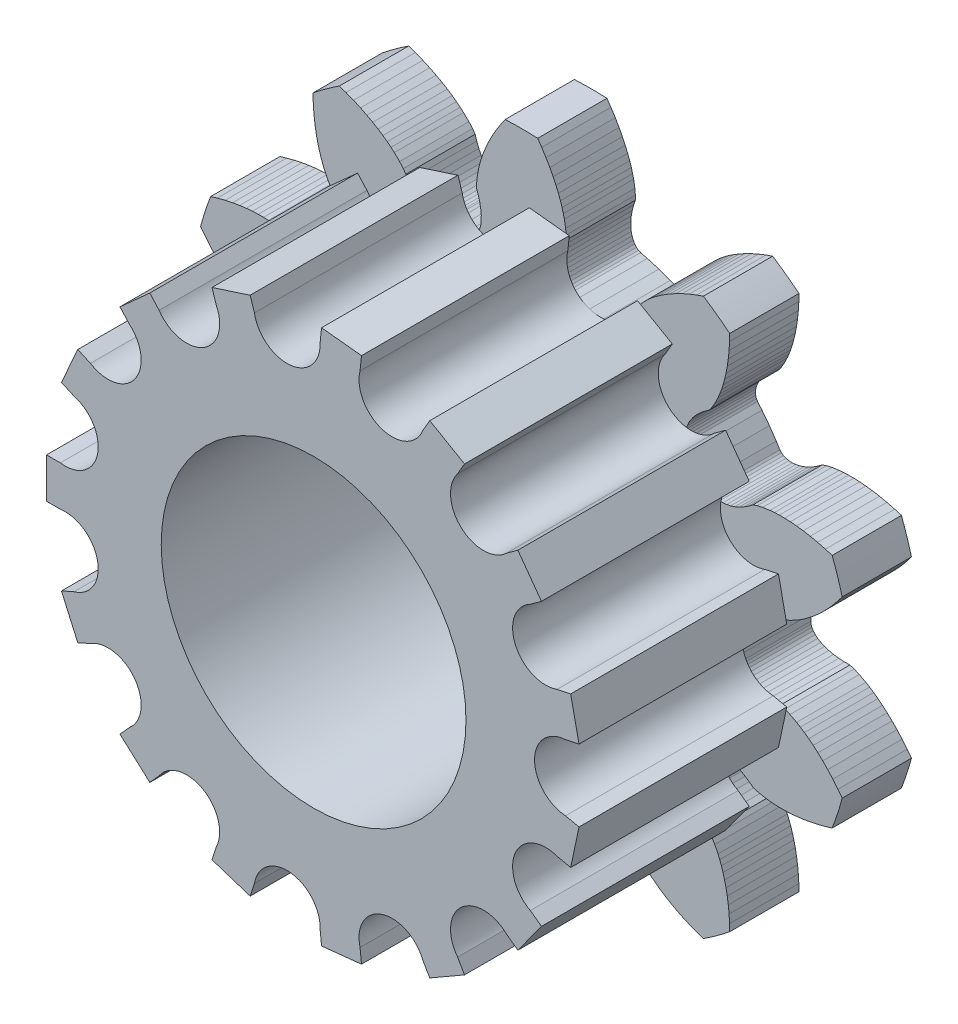
from build123d import *

# Parameters (mm, degrees)
MODEL_R             = 0.5
BOSS_EXTRUDE1_DEPTH = 5
SKETCH2_R           = 11
CUT_EXTRUDE1_DEPTH  = 87.698944957
BOSS_EXTRUDE2_DEPTH = 15
SKETCH4_R           = 11
CUT_EXTRUDE2_DEPTH  = 16


with BuildPart() as part:
    # Model → Boss-Extrude1 (new body)
    with BuildSketch(Plane.XY):
        with BuildLine():
            Line((45.0072197, -17.6135177), (44.9713648, -18.1935982))
            Line((44.9713648, -18.1935982), (44.960078413, -18.702780784))
            ThreePointArc((44.960078413, -18.702780784), (45.893236682, -19.416293937), (46.860189796, -20.083292477))
            Line((46.860189796, -20.083292477), (47.3409636, -19.9152125))
            Line((47.3409636, -19.9152125), (47.8815731, -19.7018577))
            Line((47.8815731, -19.7018577), (48.3832652, -19.4791595))
            Line((48.3832652, -19.4791595), (48.8442917, -19.2509448))
            Line((48.8442917, -19.2509448), (49.2681476, -19.0185598))
            Line((49.2681476, -19.0185598), (49.652488, -18.7863735))
            Line((49.652488, -18.7863735), (49.999784, -18.5561983))
            Line((49.999784, -18.5561983), (50.3097144, -18.3315784))
            Line((50.3097144, -18.3315784), (50.584246, -18.1145512))
            Line((50.584246, -18.1145512), (50.8253064, -17.9070155))
            Line((50.8253064, -17.9070155), (51.2090617, -17.5331754))
            Line((51.2090617, -17.5331754), (51.4736068, -17.2287023))
            Line((51.4736068, -17.2287023), (51.6609452, -16.9687186))
            Line((51.6609452, -16.9687186), (51.7766666, -16.5968373))
            Line((51.7766666, -16.5968373), (51.926219, -16.211607))
            Line((51.926219, -16.211607), (52.09214, -15.8680652))
            Line((52.09214, -15.8680652), (52.2711992, -15.5668343))
            Line((52.2711992, -15.5668343), (52.4601462, -15.3083721))
            Line((52.4601462, -15.3083721), (52.655719, -15.092912))
            Line((52.655719, -15.092912), (52.8546606, -14.9204789))
            Line((52.8546606, -14.9204789), (53.053697, -14.7909236))
            Line((53.053697, -14.7909236), (53.2496281, -14.7039005))
            Line((53.2496281, -14.7039005), (53.4392401, -14.6588488))
            Line((53.4392401, -14.6588488), (53.6193745, -14.6550368))
            Line((53.6193745, -14.6550368), (53.7869408, -14.6915235))
            Line((53.7869408, -14.6915235), (54.2459233, -14.875985))
            Line((54.2459233, -14.875985), (55.0711789, -15.1693514))
            Line((55.0711789, -15.1693514), (55.9112613, -15.4170861))
            Line((55.9112613, -15.4170861), (56.3910096, -15.5376367))
            Line((56.3910096, -15.5376367), (56.5480199, -15.6066114))
            Line((56.5480199, -15.6066114), (56.6915111, -15.7155757))
            Line((56.6915111, -15.7155757), (56.8184297, -15.8634744))
            Line((56.8184297, -15.8634744), (56.9257904, -16.0490431))
            Line((56.9257904, -16.0490431), (57.0106635, -16.2708461))
            Line((57.0106635, -16.2708461), (57.070257, -16.5272824))
            Line((57.070257, -16.5272824), (57.1018345, -16.8165481))
            Line((57.1018345, -16.8165481), (57.1027755, -17.1367086))
            Line((57.1027755, -17.1367086), (57.0705784, -17.485658))
            Line((57.0705784, -17.485658), (57.0028826, -17.861115))
            Line((57.0028826, -17.861115), (56.8974402, -18.2606775))
            Line((56.8974402, -18.2606775), (56.7724745, -18.6295551))
            Line((56.7724745, -18.6295551), (56.7712199, -18.9500011))
            Line((56.7712199, -18.9500011), (56.8062766, -19.3518207))
            Line((56.8062766, -19.3518207), (56.8970034, -19.8798294))
            Line((56.8970034, -19.8798294), (56.9700389, -20.1894211))
            Line((56.9700389, -20.1894211), (57.0645743, -20.5263654))
            Line((57.0645743, -20.5263654), (57.183285, -20.8902593))
            Line((57.183285, -20.8902593), (57.3289597, -21.2806104))
            Line((57.3289597, -21.2806104), (57.503422, -21.6943627))
            Line((57.503422, -21.6943627), (57.7097362, -22.1315024))
            Line((57.7097362, -22.1315024), (57.9485732, -22.5871164))
            Line((57.9485732, -22.5871164), (58.2235519, -23.0621703))
            Line((58.2235519, -23.0621703), (58.5355074, -23.5525403))
            Line((58.5355074, -23.5525403), (58.82566651, -23.971111584))
            ThreePointArc((58.82566651, -23.971111584), (59.999999958, -23.9998592), (61.174333407, -23.971111588))
            Line((61.174333407, -23.971111588), (61.4644926, -23.5525403))
            Line((61.4644926, -23.5525403), (61.7764481, -23.0621703))
            Line((61.7764481, -23.0621703), (62.0514268, -22.5871164))
            Line((62.0514268, -22.5871164), (62.2902638, -22.1315024))
            Line((62.2902638, -22.1315024), (62.496578, -21.6943627))
            Line((62.496578, -21.6943627), (62.6710403, -21.2806104))
            Line((62.6710403, -21.2806104), (62.816715, -20.8902593))
            Line((62.816715, -20.8902593), (62.9354257, -20.5263654))
            Line((62.9354257, -20.5263654), (63.0299611, -20.1894211))
            Line((63.0299611, -20.1894211), (63.1029966, -19.8798294))
            Line((63.1029966, -19.8798294), (63.1937234, -19.3518207))
            Line((63.1937234, -19.3518207), (63.2287801, -18.9500011))
            Line((63.2287801, -18.9500011), (63.2275255, -18.6295551))
            Line((63.2275255, -18.6295551), (63.1025598, -18.2606775))
            Line((63.1025598, -18.2606775), (62.9971174, -17.861115))
            Line((62.9971174, -17.861115), (62.9294216, -17.485658))
            Line((62.9294216, -17.485658), (62.8972245, -17.1367086))
            Line((62.8972245, -17.1367086), (62.8981655, -16.8165481))
            Line((62.8981655, -16.8165481), (62.929743, -16.5272824))
            Line((62.929743, -16.5272824), (62.9893365, -16.2708461))
            Line((62.9893365, -16.2708461), (63.0742096, -16.0490431))
            Line((63.0742096, -16.0490431), (63.1815703, -15.8634744))
            Line((63.1815703, -15.8634744), (63.3084889, -15.7155757))
            Line((63.3084889, -15.7155757), (63.4519801, -15.6066114))
            Line((63.4519801, -15.6066114), (63.6089904, -15.5376367))
            Line((63.6089904, -15.5376367), (64.0887387, -15.4170861))
            Line((64.0887387, -15.4170861), (64.9288211, -15.1693514))
            Line((64.9288211, -15.1693514), (65.7540767, -14.875985))
            Line((65.7540767, -14.875985), (66.2130592, -14.6915235))
            Line((66.2130592, -14.6915235), (66.3806255, -14.6550368))
            Line((66.3806255, -14.6550368), (66.5607599, -14.6588488))
            Line((66.5607599, -14.6588488), (66.7503719, -14.7039005))
            Line((66.7503719, -14.7039005), (66.946303, -14.7909236))
            Line((66.946303, -14.7909236), (67.1453394, -14.9204789))
            Line((67.1453394, -14.9204789), (67.344281, -15.092912))
            Line((67.344281, -15.092912), (67.5398538, -15.3083721))
            Line((67.5398538, -15.3083721), (67.7288008, -15.5668343))
            Line((67.7288008, -15.5668343), (67.90786, -15.8680652))
            Line((67.90786, -15.8680652), (68.073781, -16.211607))
            Line((68.073781, -16.211607), (68.2233334, -16.5968373))
            Line((68.2233334, -16.5968373), (68.3390548, -16.9687186))
            Line((68.3390548, -16.9687186), (68.5263932, -17.2287023))
            Line((68.5263932, -17.2287023), (68.7909383, -17.5331754))
            Line((68.7909383, -17.5331754), (69.1746936, -17.9070155))
            Line((69.1746936, -17.9070155), (69.415754, -18.1145512))
            Line((69.415754, -18.1145512), (69.6902856, -18.3315784))
            Line((69.6902856, -18.3315784), (70.000216, -18.5561983))
            Line((70.000216, -18.5561983), (70.347512, -18.7863735))
            Line((70.347512, -18.7863735), (70.7318524, -19.0185598))
            Line((70.7318524, -19.0185598), (71.1557083, -19.2509448))
            Line((71.1557083, -19.2509448), (71.6167348, -19.4791595))
            Line((71.6167348, -19.4791595), (72.1184269, -19.7018577))
            Line((72.1184269, -19.7018577), (72.6590364, -19.9152125))
            Line((72.6590364, -19.9152125), (73.139810204, -20.083292477))
            ThreePointArc((73.139810204, -20.083292477), (74.106763318, -19.416293937), (75.039921587, -18.702780784))
            Line((75.039921587, -18.702780784), (75.0286352, -18.1935982))
            Line((75.0286352, -18.1935982), (74.9927803, -17.6135177))
            Line((74.9927803, -17.6135177), (74.9360131, -17.0675626))
            Line((74.9360131, -17.0675626), (74.8614331, -16.5585782))
            Line((74.8614331, -16.5585782), (74.7714004, -16.0836564))
            Line((74.7714004, -16.0836564), (74.6693459, -15.6463774))
            Line((74.6693459, -15.6463774), (74.5577566, -15.2449512))
            Line((74.5577566, -15.2449512), (74.4399041, -14.8807785))
            Line((74.4399041, -14.8807785), (74.318334, -14.5526184))
            Line((74.318334, -14.5526184), (74.1954475, -14.2592242))
            Line((74.1954475, -14.2592242), (73.9584913, -13.7787283))
            Line((73.9584913, -13.7787283), (73.7506692, -13.4330436))
            Line((73.7506692, -13.4330436), (73.5613007, -13.1745348))
            Line((73.5613007, -13.1745348), (73.2433805, -12.9495595))
            Line((73.2433805, -12.9495595), (72.9232189, -12.6882841))
            Line((72.9232189, -12.6882841), (72.6477637, -12.4243237))
            Line((72.6477637, -12.4243237), (72.4166084, -12.1609427))
            Line((72.4166084, -12.1609427), (72.2291841, -11.9013743))
            Line((72.2291841, -11.9013743), (72.0847047, -11.6487926))
            Line((72.0847047, -11.6487926), (71.9821874, -11.4063031))
            Line((71.9821874, -11.4063031), (71.9204786, -11.1769735))
            Line((71.9204786, -11.1769735), (71.8982608, -10.9637403))
            Line((71.8982608, -10.9637403), (71.9140074, -10.7694868))
            Line((71.9140074, -10.7694868), (71.9660466, -10.5969909))
            Line((71.9660466, -10.5969909), (72.0525282, -10.4489008))
            Line((72.0525282, -10.4489008), (72.369795, -10.0693844))
            Line((72.369795, -10.0693844), (72.9038211, -9.3751748))
            Line((72.9038211, -9.3751748), (73.3990305, -8.6527632))
            Line((73.3990305, -8.6527632), (73.6619313, -8.2337476))
            Line((73.6619313, -8.2337476), (73.776049, -8.1057363))
            Line((73.776049, -8.1057363), (73.9240214, -8.0029399))
            Line((73.9240214, -8.0029399), (74.1039014, -7.9279364))
            Line((74.1039014, -7.9279364), (74.313564, -7.8831741))
            Line((74.313564, -7.8831741), (74.5507384, -7.8709959))
            Line((74.5507384, -7.8709959), (74.8130393, -7.8935623))
            Line((74.8130393, -7.8935623), (75.0979052, -7.9529183))
            Line((75.0979052, -7.9529183), (75.4026868, -8.0509584))
            Line((75.4026868, -8.0509584), (75.7246079, -8.1894109))
            Line((75.7246079, -8.1894109), (76.0607696, -8.3698161))
            Line((76.0607696, -8.3698161), (76.4081926, -8.5935693))
            Line((76.4081926, -8.5935693), (76.7203996, -8.8264083))
            Line((76.7203996, -8.8264083), (77.0247741, -8.9266248))
            Line((77.0247741, -8.9266248), (77.4177604, -9.0174529))
            Line((77.4177604, -9.0174529), (77.9479626, -9.0943303))
            Line((77.9479626, -9.0943303), (78.2649711, -9.1205385))
            Line((78.2649711, -9.1205385), (78.6146371, -9.1347515))
            Line((78.6146371, -9.1347515), (78.9974044, -9.1343003))
            Line((78.9974044, -9.1343003), (79.4136663, -9.1163805))
            Line((79.4136663, -9.1163805), (79.86108, -9.0783135))
            Line((79.86108, -9.0783135), (80.3405791, -9.0171807))
            Line((80.3405791, -9.0171807), (80.8476985, -8.9308257))
            Line((80.8476985, -8.9308257), (81.3844747, -8.8161051))
            Line((81.3844747, -8.8161051), (81.9472438, -8.6709504))
            Line((81.9472438, -8.6709504), (82.434992789, -8.524338316))
            ThreePointArc((82.434992789, -8.524338316), (82.825222394, -7.416364364), (83.16077079, -6.290623409))
            Line((83.16077079, -6.290623409), (82.85235, -5.88532))
            Line((82.85235, -5.88532), (82.48238, -5.4371))
            Line((82.48238, -5.4371), (82.11555, -5.02878))
            Line((82.11555, -5.02878), (81.75604, -4.66084))
            Line((81.75604, -4.66084), (81.40405, -4.32954))
            Line((81.40405, -4.32954), (81.06446, -4.03576))
            Line((81.06446, -4.03576), (80.73823, -3.77659))
            Line((80.73823, -3.77659), (80.42883, -3.55124))
            Line((80.42883, -3.55124), (80.13759, -3.35721))
            Line((80.13759, -3.35721), (79.86572, -3.19208))
            Line((79.86572, -3.19208), (79.39159, -2.94263))
            Line((79.39159, -2.94263), (79.02027, -2.78512))
            Line((79.02027, -2.78512), (78.71512, -2.68729))
            Line((78.71512, -2.68729), (78.32568, -2.69215))
            Line((78.32568, -2.69215), (77.91309, -2.66896))
            Line((77.91309, -2.66896), (77.53509, -2.61732))
            Line((77.53509, -2.61732), (77.19327, -2.54011))
            Line((77.19327, -2.54011), (76.88907, -2.44028))
            Line((76.88907, -2.44028), (76.62372, -2.32086))
            Line((76.62372, -2.32086), (76.39825, -2.18494))
            Line((76.39825, -2.18494), (76.21353, -2.03568))
            Line((76.21353, -2.03568), (76.07022, -1.87623))
            Line((76.07022, -1.87623), (75.96878, -1.70982))
            Line((75.96878, -1.70982), (75.90949, -1.53968))
            Line((75.90949, -1.53968), (75.89241, -1.36904))
            Line((75.89241, -1.36904), (75.92601, -0.87552))
            Line((75.92601, -0.87552), (75.95, 0))
            Line((75.95, 0), (75.92601, 0.87552))
            Line((75.92601, 0.87552), (75.89241, 1.36904))
            Line((75.89241, 1.36904), (75.90949, 1.53968))
            Line((75.90949, 1.53968), (75.96878, 1.70982))
            Line((75.96878, 1.70982), (76.07022, 1.87623))
            Line((76.07022, 1.87623), (76.21353, 2.03568))
            Line((76.21353, 2.03568), (76.39825, 2.18494))
            Line((76.39825, 2.18494), (76.62372, 2.32086))
            Line((76.62372, 2.32086), (76.88907, 2.44028))
            Line((76.88907, 2.44028), (77.19327, 2.54011))
            Line((77.19327, 2.54011), (77.53509, 2.61732))
            Line((77.53509, 2.61732), (77.91309, 2.66896))
            Line((77.91309, 2.66896), (78.32568, 2.69215))
            Line((78.32568, 2.69215), (78.71512, 2.68729))
            Line((78.71512, 2.68729), (79.02027, 2.78512))
            Line((79.02027, 2.78512), (79.39159, 2.94263))
            Line((79.39159, 2.94263), (79.86572, 3.19208))
            Line((79.86572, 3.19208), (80.13759, 3.35721))
            Line((80.13759, 3.35721), (80.42883, 3.55124))
            Line((80.42883, 3.55124), (80.73823, 3.77659))
            Line((80.73823, 3.77659), (81.06446, 4.03576))
            Line((81.06446, 4.03576), (81.40405, 4.32954))
            Line((81.40405, 4.32954), (81.75604, 4.66084))
            Line((81.75604, 4.66084), (82.11555, 5.02878))
            Line((82.11555, 5.02878), (82.48238, 5.4371))
            Line((82.48238, 5.4371), (82.85235, 5.88532))
            Line((82.85235, 5.88532), (83.16077089, 6.290623409))
            ThreePointArc((83.16077089, 6.290623409), (82.825222494, 7.416364364), (82.434992889, 8.524338316))
            Line((82.434992889, 8.524338316), (81.9472438, 8.6709504))
            Line((81.9472438, 8.6709504), (81.3844747, 8.8161051))
            Line((81.3844747, 8.8161051), (80.8476985, 8.9308257))
            Line((80.8476985, 8.9308257), (80.3405791, 9.0171807))
            Line((80.3405791, 9.0171807), (79.86108, 9.0783135))
            Line((79.86108, 9.0783135), (79.4136663, 9.1163805))
            Line((79.4136663, 9.1163805), (78.9974044, 9.1343003))
            Line((78.9974044, 9.1343003), (78.6146371, 9.1347515))
            Line((78.6146371, 9.1347515), (78.2649711, 9.1205385))
            Line((78.2649711, 9.1205385), (77.9479626, 9.0943303))
            Line((77.9479626, 9.0943303), (77.4177604, 9.0174529))
            Line((77.4177604, 9.0174529), (77.0247741, 8.9266248))
            Line((77.0247741, 8.9266248), (76.7203996, 8.8264083))
            Line((76.7203996, 8.8264083), (76.4081926, 8.5935693))
            Line((76.4081926, 8.5935693), (76.0607696, 8.3698161))
            Line((76.0607696, 8.3698161), (75.7246079, 8.1894109))
            Line((75.7246079, 8.1894109), (75.4026868, 8.0509584))
            Line((75.4026868, 8.0509584), (75.0979052, 7.9529183))
            Line((75.0979052, 7.9529183), (74.8130393, 7.8935623))
            Line((74.8130393, 7.8935623), (74.5507384, 7.8709959))
            Line((74.5507384, 7.8709959), (74.313564, 7.8831741))
            Line((74.313564, 7.8831741), (74.1039014, 7.9279364))
            Line((74.1039014, 7.9279364), (73.9240214, 8.0029399))
            Line((73.9240214, 8.0029399), (73.776049, 8.1057363))
            Line((73.776049, 8.1057363), (73.6619313, 8.2337476))
            Line((73.6619313, 8.2337476), (73.3990305, 8.6527632))
            Line((73.3990305, 8.6527632), (72.9038211, 9.3751748))
            Line((72.9038211, 9.3751748), (72.369795, 10.0693844))
            Line((72.369795, 10.0693844), (72.0525282, 10.4489008))
            Line((72.0525282, 10.4489008), (71.9660466, 10.5969909))
            Line((71.9660466, 10.5969909), (71.9140074, 10.7694868))
            Line((71.9140074, 10.7694868), (71.8982608, 10.9637403))
            Line((71.8982608, 10.9637403), (71.9204786, 11.1769735))
            Line((71.9204786, 11.1769735), (71.9821874, 11.4063031))
            Line((71.9821874, 11.4063031), (72.0847047, 11.6487926))
            Line((72.0847047, 11.6487926), (72.2291841, 11.9013743))
            Line((72.2291841, 11.9013743), (72.4166084, 12.1609427))
            Line((72.4166084, 12.1609427), (72.6477637, 12.4243237))
            Line((72.6477637, 12.4243237), (72.9232189, 12.6882841))
            Line((72.9232189, 12.6882841), (73.2433805, 12.9495595))
            Line((73.2433805, 12.9495595), (73.5613007, 13.1745348))
            Line((73.5613007, 13.1745348), (73.7506692, 13.4330436))
            Line((73.7506692, 13.4330436), (73.9584913, 13.7787283))
            Line((73.9584913, 13.7787283), (74.1954475, 14.2592242))
            Line((74.1954475, 14.2592242), (74.318334, 14.5526184))
            Line((74.318334, 14.5526184), (74.4399041, 14.8807785))
            Line((74.4399041, 14.8807785), (74.5577566, 15.2449512))
            Line((74.5577566, 15.2449512), (74.6693459, 15.6463774))
            Line((74.6693459, 15.6463774), (74.7714004, 16.0836564))
            Line((74.7714004, 16.0836564), (74.8614331, 16.5585782))
            Line((74.8614331, 16.5585782), (74.9360131, 17.0675626))
            Line((74.9360131, 17.0675626), (74.9927803, 17.6135177))
            Line((74.9927803, 17.6135177), (75.0286352, 18.1935982))
            Line((75.0286352, 18.1935982), (75.039921587, 18.702780784))
            ThreePointArc((75.039921587, 18.702780784), (74.106763318, 19.416293937), (73.139810204, 20.083292477))
            Line((73.139810204, 20.083292477), (72.6590364, 19.9152125))
            Line((72.6590364, 19.9152125), (72.1184269, 19.7018577))
            Line((72.1184269, 19.7018577), (71.6167348, 19.4791595))
            Line((71.6167348, 19.4791595), (71.1557083, 19.2509448))
            Line((71.1557083, 19.2509448), (70.7318524, 19.0185598))
            Line((70.7318524, 19.0185598), (70.347512, 18.7863735))
            Line((70.347512, 18.7863735), (70.000216, 18.5561983))
            Line((70.000216, 18.5561983), (69.6902856, 18.3315784))
            Line((69.6902856, 18.3315784), (69.415754, 18.1145512))
            Line((69.415754, 18.1145512), (69.1746936, 17.9070155))
            Line((69.1746936, 17.9070155), (68.7909383, 17.5331754))
            Line((68.7909383, 17.5331754), (68.5263932, 17.2287023))
            Line((68.5263932, 17.2287023), (68.3390548, 16.9687186))
            Line((68.3390548, 16.9687186), (68.2233334, 16.5968373))
            Line((68.2233334, 16.5968373), (68.073781, 16.211607))
            Line((68.073781, 16.211607), (67.90786, 15.8680652))
            Line((67.90786, 15.8680652), (67.7288008, 15.5668343))
            Line((67.7288008, 15.5668343), (67.5398538, 15.3083721))
            Line((67.5398538, 15.3083721), (67.344281, 15.092912))
            Line((67.344281, 15.092912), (67.1453394, 14.9204789))
            Line((67.1453394, 14.9204789), (66.946303, 14.7909236))
            Line((66.946303, 14.7909236), (66.7503719, 14.7039005))
            Line((66.7503719, 14.7039005), (66.5607599, 14.6588488))
            Line((66.5607599, 14.6588488), (66.3806255, 14.6550368))
            Line((66.3806255, 14.6550368), (66.2130592, 14.6915235))
            Line((66.2130592, 14.6915235), (65.7540767, 14.875985))
            Line((65.7540767, 14.875985), (64.9288211, 15.1693514))
            Line((64.9288211, 15.1693514), (64.0887387, 15.4170861))
            Line((64.0887387, 15.4170861), (63.6089904, 15.5376367))
            Line((63.6089904, 15.5376367), (63.4519801, 15.6066114))
            Line((63.4519801, 15.6066114), (63.3084889, 15.7155757))
            Line((63.3084889, 15.7155757), (63.1815703, 15.8634744))
            Line((63.1815703, 15.8634744), (63.0742096, 16.0490431))
            Line((63.0742096, 16.0490431), (62.9893365, 16.2708461))
            Line((62.9893365, 16.2708461), (62.929743, 16.5272824))
            Line((62.929743, 16.5272824), (62.8981655, 16.8165481))
            Line((62.8981655, 16.8165481), (62.8972245, 17.1367086))
            Line((62.8972245, 17.1367086), (62.9294216, 17.485658))
            Line((62.9294216, 17.485658), (62.9971174, 17.861115))
            Line((62.9971174, 17.861115), (63.1025598, 18.2606775))
            Line((63.1025598, 18.2606775), (63.2275255, 18.6295551))
            Line((63.2275255, 18.6295551), (63.2287801, 18.9500011))
            Line((63.2287801, 18.9500011), (63.1937234, 19.3518207))
            Line((63.1937234, 19.3518207), (63.1029966, 19.8798294))
            Line((63.1029966, 19.8798294), (63.0299611, 20.1894211))
            Line((63.0299611, 20.1894211), (62.9354257, 20.5263654))
            Line((62.9354257, 20.5263654), (62.816715, 20.8902593))
            Line((62.816715, 20.8902593), (62.6710403, 21.2806104))
            Line((62.6710403, 21.2806104), (62.496578, 21.6943627))
            Line((62.496578, 21.6943627), (62.2902638, 22.1315024))
            Line((62.2902638, 22.1315024), (62.0514268, 22.5871164))
            Line((62.0514268, 22.5871164), (61.7764481, 23.0621703))
            Line((61.7764481, 23.0621703), (61.4644926, 23.5525403))
            Line((61.4644926, 23.5525403), (61.17433349, 23.971111584))
            ThreePointArc((61.17433349, 23.971111584), (60.000000042, 23.9998592), (58.825666593, 23.971111588))
            Line((58.825666593, 23.971111588), (58.5355074, 23.5525403))
            Line((58.5355074, 23.5525403), (58.2235519, 23.0621703))
            Line((58.2235519, 23.0621703), (57.9485732, 22.5871164))
            Line((57.9485732, 22.5871164), (57.7097362, 22.1315024))
            Line((57.7097362, 22.1315024), (57.503422, 21.6943627))
            Line((57.503422, 21.6943627), (57.3289597, 21.2806104))
            Line((57.3289597, 21.2806104), (57.183285, 20.8902593))
            Line((57.183285, 20.8902593), (57.0645743, 20.5263654))
            Line((57.0645743, 20.5263654), (56.9700389, 20.1894211))
            Line((56.9700389, 20.1894211), (56.8970034, 19.8798294))
            Line((56.8970034, 19.8798294), (56.8062766, 19.3518207))
            Line((56.8062766, 19.3518207), (56.7712199, 18.9500011))
            Line((56.7712199, 18.9500011), (56.7724745, 18.6295551))
            Line((56.7724745, 18.6295551), (56.8974402, 18.2606775))
            Line((56.8974402, 18.2606775), (57.0028826, 17.861115))
            Line((57.0028826, 17.861115), (57.0705784, 17.485658))
            Line((57.0705784, 17.485658), (57.1027755, 17.1367086))
            Line((57.1027755, 17.1367086), (57.1018345, 16.8165481))
            Line((57.1018345, 16.8165481), (57.070257, 16.5272824))
            Line((57.070257, 16.5272824), (57.0106635, 16.2708461))
            Line((57.0106635, 16.2708461), (56.9257904, 16.0490431))
            Line((56.9257904, 16.0490431), (56.8184297, 15.8634744))
            Line((56.8184297, 15.8634744), (56.6915111, 15.7155757))
            Line((56.6915111, 15.7155757), (56.5480199, 15.6066114))
            Line((56.5480199, 15.6066114), (56.3910096, 15.5376367))
            Line((56.3910096, 15.5376367), (55.9112613, 15.4170861))
            Line((55.9112613, 15.4170861), (55.0711789, 15.1693514))
            Line((55.0711789, 15.1693514), (54.2459233, 14.875985))
            Line((54.2459233, 14.875985), (53.7869408, 14.6915235))
            Line((53.7869408, 14.6915235), (53.6193745, 14.6550368))
            Line((53.6193745, 14.6550368), (53.4392401, 14.6588488))
            Line((53.4392401, 14.6588488), (53.2496281, 14.7039005))
            Line((53.2496281, 14.7039005), (53.053697, 14.7909236))
            Line((53.053697, 14.7909236), (52.8546606, 14.9204789))
            Line((52.8546606, 14.9204789), (52.655719, 15.092912))
            Line((52.655719, 15.092912), (52.4601462, 15.3083721))
            Line((52.4601462, 15.3083721), (52.2711992, 15.5668343))
            Line((52.2711992, 15.5668343), (52.09214, 15.8680652))
            Line((52.09214, 15.8680652), (51.926219, 16.211607))
            Line((51.926219, 16.211607), (51.7766666, 16.5968373))
            Line((51.7766666, 16.5968373), (51.6609452, 16.9687186))
            Line((51.6609452, 16.9687186), (51.4736068, 17.2287023))
            Line((51.4736068, 17.2287023), (51.2090617, 17.5331754))
            Line((51.2090617, 17.5331754), (50.8253064, 17.9070155))
            Line((50.8253064, 17.9070155), (50.584246, 18.1145512))
            Line((50.584246, 18.1145512), (50.3097144, 18.3315784))
            Line((50.3097144, 18.3315784), (49.999784, 18.5561983))
            Line((49.999784, 18.5561983), (49.652488, 18.7863735))
            Line((49.652488, 18.7863735), (49.2681476, 19.0185598))
            Line((49.2681476, 19.0185598), (48.8442917, 19.2509448))
            Line((48.8442917, 19.2509448), (48.3832652, 19.4791595))
            Line((48.3832652, 19.4791595), (47.8815731, 19.7018577))
            Line((47.8815731, 19.7018577), (47.3409636, 19.9152125))
            Line((47.3409636, 19.9152125), (46.860189796, 20.083292477))
            ThreePointArc((46.860189796, 20.083292477), (45.893236682, 19.416293937), (44.960078413, 18.702780784))
            Line((44.960078413, 18.702780784), (44.9713648, 18.1935982))
            Line((44.9713648, 18.1935982), (45.0072197, 17.6135177))
            Line((45.0072197, 17.6135177), (45.0639869, 17.0675626))
            Line((45.0639869, 17.0675626), (45.1385669, 16.5585782))
            Line((45.1385669, 16.5585782), (45.2285996, 16.0836564))
            Line((45.2285996, 16.0836564), (45.3306541, 15.6463774))
            Line((45.3306541, 15.6463774), (45.4422434, 15.2449512))
            Line((45.4422434, 15.2449512), (45.5600959, 14.8807785))
            Line((45.5600959, 14.8807785), (45.681666, 14.5526184))
            Line((45.681666, 14.5526184), (45.8045525, 14.2592242))
            Line((45.8045525, 14.2592242), (46.0415087, 13.7787283))
            Line((46.0415087, 13.7787283), (46.2493308, 13.4330436))
            Line((46.2493308, 13.4330436), (46.4386993, 13.1745348))
            Line((46.4386993, 13.1745348), (46.7566195, 12.9495595))
            Line((46.7566195, 12.9495595), (47.0767811, 12.6882841))
            Line((47.0767811, 12.6882841), (47.3522363, 12.4243237))
            Line((47.3522363, 12.4243237), (47.5833916, 12.1609427))
            Line((47.5833916, 12.1609427), (47.7708159, 11.9013743))
            Line((47.7708159, 11.9013743), (47.9152953, 11.6487926))
            Line((47.9152953, 11.6487926), (48.0178126, 11.4063031))
            Line((48.0178126, 11.4063031), (48.0795214, 11.1769735))
            Line((48.0795214, 11.1769735), (48.1017392, 10.9637403))
            Line((48.1017392, 10.9637403), (48.0859926, 10.7694868))
            Line((48.0859926, 10.7694868), (48.0339534, 10.5969909))
            Line((48.0339534, 10.5969909), (47.9474718, 10.4489008))
            Line((47.9474718, 10.4489008), (47.630205, 10.0693844))
            Line((47.630205, 10.0693844), (47.0961789, 9.3751748))
            Line((47.0961789, 9.3751748), (46.6009695, 8.6527632))
            Line((46.6009695, 8.6527632), (46.3380687, 8.2337476))
            Line((46.3380687, 8.2337476), (46.223951, 8.1057363))
            Line((46.223951, 8.1057363), (46.0759786, 8.0029399))
            Line((46.0759786, 8.0029399), (45.8960986, 7.9279364))
            Line((45.8960986, 7.9279364), (45.686436, 7.8831741))
            Line((45.686436, 7.8831741), (45.4492616, 7.8709959))
            Line((45.4492616, 7.8709959), (45.1869607, 7.8935623))
            Line((45.1869607, 7.8935623), (44.9020948, 7.9529183))
            Line((44.9020948, 7.9529183), (44.5973132, 8.0509584))
            Line((44.5973132, 8.0509584), (44.2753921, 8.1894109))
            Line((44.2753921, 8.1894109), (43.9392304, 8.3698161))
            Line((43.9392304, 8.3698161), (43.5918074, 8.5935693))
            Line((43.5918074, 8.5935693), (43.2796004, 8.8264083))
            Line((43.2796004, 8.8264083), (42.9752259, 8.9266248))
            Line((42.9752259, 8.9266248), (42.5822396, 9.0174529))
            Line((42.5822396, 9.0174529), (42.0520374, 9.0943303))
            Line((42.0520374, 9.0943303), (41.7350289, 9.1205385))
            Line((41.7350289, 9.1205385), (41.3853629, 9.1347515))
            Line((41.3853629, 9.1347515), (41.0025956, 9.1343003))
            Line((41.0025956, 9.1343003), (40.5863337, 9.1163805))
            Line((40.5863337, 9.1163805), (40.13892, 9.0783135))
            Line((40.13892, 9.0783135), (39.6594209, 9.0171807))
            Line((39.6594209, 9.0171807), (39.1523015, 8.9308257))
            Line((39.1523015, 8.9308257), (38.6155253, 8.8161051))
            Line((38.6155253, 8.8161051), (38.0527562, 8.6709504))
            Line((38.0527562, 8.6709504), (37.565007211, 8.524338316))
            ThreePointArc((37.565007211, 8.524338316), (37.174777606, 7.416364364), (36.83922921, 6.290623409))
            Line((36.83922921, 6.290623409), (37.14765, 5.88532))
            Line((37.14765, 5.88532), (37.51762, 5.4371))
            Line((37.51762, 5.4371), (37.88445, 5.02878))
            Line((37.88445, 5.02878), (38.24396, 4.66084))
            Line((38.24396, 4.66084), (38.59595, 4.32954))
            Line((38.59595, 4.32954), (38.93554, 4.03576))
            Line((38.93554, 4.03576), (39.26177, 3.77659))
            Line((39.26177, 3.77659), (39.57117, 3.55124))
            Line((39.57117, 3.55124), (39.86241, 3.35721))
            Line((39.86241, 3.35721), (40.13428, 3.19208))
            Line((40.13428, 3.19208), (40.60841, 2.94263))
            Line((40.60841, 2.94263), (40.97973, 2.78512))
            Line((40.97973, 2.78512), (41.28488, 2.68729))
            Line((41.28488, 2.68729), (41.67432, 2.69215))
            Line((41.67432, 2.69215), (42.08691, 2.66896))
            Line((42.08691, 2.66896), (42.46491, 2.61732))
            Line((42.46491, 2.61732), (42.80673, 2.54011))
            Line((42.80673, 2.54011), (43.11093, 2.44028))
            Line((43.11093, 2.44028), (43.37628, 2.32086))
            Line((43.37628, 2.32086), (43.60175, 2.18494))
            Line((43.60175, 2.18494), (43.78647, 2.03568))
            Line((43.78647, 2.03568), (43.92978, 1.87623))
            Line((43.92978, 1.87623), (44.03122, 1.70982))
            Line((44.03122, 1.70982), (44.09051, 1.53968))
            Line((44.09051, 1.53968), (44.10759, 1.36904))
            Line((44.10759, 1.36904), (44.07399, 0.87552))
            Line((44.07399, 0.87552), (44.05, 0))
            Line((44.05, 0), (44.07399, -0.87552))
            Line((44.07399, -0.87552), (44.10759, -1.36904))
            Line((44.10759, -1.36904), (44.09051, -1.53968))
            Line((44.09051, -1.53968), (44.03122, -1.70982))
            Line((44.03122, -1.70982), (43.92978, -1.87623))
            Line((43.92978, -1.87623), (43.78647, -2.03568))
            Line((43.78647, -2.03568), (43.60175, -2.18494))
            Line((43.60175, -2.18494), (43.37628, -2.32086))
            Line((43.37628, -2.32086), (43.11093, -2.44028))
            Line((43.11093, -2.44028), (42.80673, -2.54011))
            Line((42.80673, -2.54011), (42.46491, -2.61732))
            Line((42.46491, -2.61732), (42.08691, -2.66896))
            Line((42.08691, -2.66896), (41.67432, -2.69215))
            Line((41.67432, -2.69215), (41.28488, -2.68729))
            Line((41.28488, -2.68729), (40.97973, -2.78512))
            Line((40.97973, -2.78512), (40.60841, -2.94263))
            Line((40.60841, -2.94263), (40.13428, -3.19208))
            Line((40.13428, -3.19208), (39.86241, -3.35721))
            Line((39.86241, -3.35721), (39.57117, -3.55124))
            Line((39.57117, -3.55124), (39.26177, -3.77659))
            Line((39.26177, -3.77659), (38.93554, -4.03576))
            Line((38.93554, -4.03576), (38.59595, -4.32954))
            Line((38.59595, -4.32954), (38.24396, -4.66084))
            Line((38.24396, -4.66084), (37.88445, -5.02878))
            Line((37.88445, -5.02878), (37.51762, -5.4371))
            Line((37.51762, -5.4371), (37.14765, -5.88532))
            Line((37.14765, -5.88532), (36.83922911, -6.290623409))
            ThreePointArc((36.83922911, -6.290623409), (37.174777506, -7.416364364), (37.565007111, -8.524338316))
            Line((37.565007111, -8.524338316), (38.0527562, -8.6709504))
            Line((38.0527562, -8.6709504), (38.6155253, -8.8161051))
            Line((38.6155253, -8.8161051), (39.1523015, -8.9308257))
            Line((39.1523015, -8.9308257), (39.6594209, -9.0171807))
            Line((39.6594209, -9.0171807), (40.13892, -9.0783135))
            Line((40.13892, -9.0783135), (40.5863337, -9.1163805))
            Line((40.5863337, -9.1163805), (41.0025956, -9.1343003))
            Line((41.0025956, -9.1343003), (41.3853629, -9.1347515))
            Line((41.3853629, -9.1347515), (41.7350289, -9.1205385))
            Line((41.7350289, -9.1205385), (42.0520374, -9.0943303))
            Line((42.0520374, -9.0943303), (42.5822396, -9.0174529))
            Line((42.5822396, -9.0174529), (42.9752259, -8.9266248))
            Line((42.9752259, -8.9266248), (43.2796004, -8.8264083))
            Line((43.2796004, -8.8264083), (43.5918074, -8.5935693))
            Line((43.5918074, -8.5935693), (43.9392304, -8.3698161))
            Line((43.9392304, -8.3698161), (44.2753921, -8.1894109))
            Line((44.2753921, -8.1894109), (44.5973132, -8.0509584))
            Line((44.5973132, -8.0509584), (44.9020948, -7.9529183))
            Line((44.9020948, -7.9529183), (45.1869607, -7.8935623))
            Line((45.1869607, -7.8935623), (45.4492616, -7.8709959))
            Line((45.4492616, -7.8709959), (45.686436, -7.8831741))
            Line((45.686436, -7.8831741), (45.8960986, -7.9279364))
            Line((45.8960986, -7.9279364), (46.0759786, -8.0029399))
            Line((46.0759786, -8.0029399), (46.223951, -8.1057363))
            Line((46.223951, -8.1057363), (46.3380687, -8.2337476))
            Line((46.3380687, -8.2337476), (46.6009695, -8.6527632))
            Line((46.6009695, -8.6527632), (47.0961789, -9.3751748))
            Line((47.0961789, -9.3751748), (47.630205, -10.0693844))
            Line((47.630205, -10.0693844), (47.9474718, -10.4489008))
            Line((47.9474718, -10.4489008), (48.0339534, -10.5969909))
            Line((48.0339534, -10.5969909), (48.0859926, -10.7694868))
            Line((48.0859926, -10.7694868), (48.1017392, -10.9637403))
            Line((48.1017392, -10.9637403), (48.0795214, -11.1769735))
            Line((48.0795214, -11.1769735), (48.0178126, -11.4063031))
            Line((48.0178126, -11.4063031), (47.9152953, -11.6487926))
            Line((47.9152953, -11.6487926), (47.7708159, -11.9013743))
            Line((47.7708159, -11.9013743), (47.5833916, -12.1609427))
            Line((47.5833916, -12.1609427), (47.3522363, -12.4243237))
            Line((47.3522363, -12.4243237), (47.0767811, -12.6882841))
            Line((47.0767811, -12.6882841), (46.7566195, -12.9495595))
            Line((46.7566195, -12.9495595), (46.4386993, -13.1745348))
            Line((46.4386993, -13.1745348), (46.2493308, -13.4330436))
            Line((46.2493308, -13.4330436), (46.0415087, -13.7787283))
            Line((46.0415087, -13.7787283), (45.8045525, -14.2592242))
            Line((45.8045525, -14.2592242), (45.681666, -14.5526184))
            Line((45.681666, -14.5526184), (45.5600959, -14.8807785))
            Line((45.5600959, -14.8807785), (45.4422434, -15.2449512))
            Line((45.4422434, -15.2449512), (45.3306541, -15.6463774))
            Line((45.3306541, -15.6463774), (45.2285996, -16.0836564))
            Line((45.2285996, -16.0836564), (45.1385669, -16.5585782))
            Line((45.1385669, -16.5585782), (45.0639869, -17.0675626))
            Line((45.0639869, -17.0675626), (45.0072197, -17.6135177))
        make_face()
        with Locations((60, 0)):
            Circle(MODEL_R, mode=Mode.SUBTRACT)
    extrude(amount=BOSS_EXTRUDE1_DEPTH)

    # Sketch2 → Cut-Extrude1 (cut, through all)
    with BuildSketch(Plane(origin=(0, 0, 0), x_dir=(-1, 0, 0), z_dir=(0, 0, -1))):
        with Locations((-60, 0)):
            Circle(SKETCH2_R)
    extrude(amount=-CUT_EXTRUDE1_DEPTH, mode=Mode.SUBTRACT)

    # Sketch3 → Boss-Extrude2 (add)
    with BuildSketch(Plane.XY.offset(5)):
        with BuildLine():
            Line((68.384885381, 17.422204495), (67.884885379, 16.556179093))
            ThreePointArc((67.884885379, 16.556179093), (64.9288211, 15.1693514), (63.352471745, 18.028849569))
            Line((63.352471745, 18.028849569), (63.457000211, 19.023371464))
            Line((63.457000211, 19.023371464), (60.573724982, 19.326415911))
            Line((60.573724982, 19.326415911), (60.469196515, 18.331894016))
            ThreePointArc((60.469196515, 18.331894016), (60.470598061, 18.284676528), (60.471065304, 18.237440554))
            ThreePointArc((60.471065304, 18.237440554), (58.285745011, 15.858151395), (55.729641582, 17.833746734))
            Line((55.729641582, 17.833746734), (55.420624591, 18.784803251))
            Line((55.420624591, 18.784803251), (52.663362321, 17.888914441))
            Line((52.663362321, 17.888914441), (52.972379312, 16.937857924))
            ThreePointArc((52.972379312, 16.937857924), (53.156489571, 16.423663502), (53.218948804, 15.881085088))
            ThreePointArc((53.218948804, 15.881085088), (51.523883745, 13.595907274), (48.845195185, 14.555027074))
            Line((48.845195185, 14.555027074), (48.176064581, 15.298171901))
            Line((48.176064581, 15.298171901), (46.021570966, 13.358257149))
            Line((46.021570966, 13.358257149), (46.69070157, 12.615112321))
            ThreePointArc((46.69070157, 12.615112321), (47.326142796, 11.792953309), (47.552226829, 10.778745736))
            ThreePointArc((47.552226829, 10.778745736), (46.317136903, 8.687552501), (43.889515878, 8.759611004))
            Line((43.889515878, 8.759611004), (42.975970422, 9.16634765))
            Line((42.975970422, 9.16634765), (41.796776981, 6.517835839))
            Line((41.796776981, 6.517835839), (42.710322437, 6.111099193))
            ThreePointArc((42.710322437, 6.111099193), (43.966536634, 5.254174319), (44.45072709, 3.812663323))
            ThreePointArc((44.45072709, 3.812663323), (43.625229074, 2.006849848), (41.719485636, 1.449578614))
            Line((41.719485636, 1.449578614), (40.719485636, 1.449578617))
            Line((40.719485636, 1.449578617), (40.719485627, -1.449578499))
            Line((40.719485627, -1.449578499), (41.719485627, -1.449578502))
            ThreePointArc((41.719485627, -1.449578502), (43.625229056, -2.006849744), (44.450727067, -3.812663214))
            ThreePointArc((44.450727067, -3.812663214), (43.966536606, -5.254174216), (42.7103224, -6.111099088))
            Line((42.7103224, -6.111099088), (41.796776941, -6.517835728))
            Line((41.796776941, -6.517835728), (42.975970366, -9.166347547))
            Line((42.975970366, -9.166347547), (43.889515825, -8.759610906))
            ThreePointArc((43.889515825, -8.759610906), (46.317136844, -8.687552414), (47.552226764, -10.778745645))
            ThreePointArc((47.552226764, -10.778745645), (47.326142727, -11.792953225), (46.690701493, -12.61511224))
            Line((46.690701493, -12.61511224), (46.021570884, -13.358257064))
            Line((46.021570884, -13.358257064), (48.176064487, -15.298171829))
            Line((48.176064487, -15.298171829), (48.845195096, -14.555027006))
            ThreePointArc((48.845195096, -14.555027006), (51.523883656, -13.59590722), (53.218948707, -15.881085032))
            ThreePointArc((53.218948707, -15.881085032), (53.156489473, -16.423663453), (52.972379209, -16.937857881))
            Line((52.972379209, -16.937857881), (52.663362212, -17.888914397))
            Line((52.663362212, -17.888914397), (55.420624476, -18.784803223))
            Line((55.420624476, -18.784803223), (55.729641473, -17.833746708))
            ThreePointArc((55.729641473, -17.833746708), (58.285744907, -15.858151384), (60.471065192, -18.237440542))
            ThreePointArc((60.471065192, -18.237440542), (60.47059795, -18.284676523), (60.469196404, -18.331894019))
            Line((60.469196404, -18.331894019), (60.573724864, -19.326415915))
            Line((60.573724864, -19.326415915), (63.457000095, -19.023371485))
            Line((63.457000095, -19.023371485), (63.352471635, -18.02884959))
            ThreePointArc((63.352471635, -18.02884959), (64.928821008, -15.16935143), (67.884885278, -16.556179141))
            Line((67.884885278, -16.556179141), (68.384885275, -17.422204546))
            Line((68.384885275, -17.422204546), (70.895628992, -15.972625996))
            Line((70.895628992, -15.972625996), (70.395628995, -15.10660059))
            ThreePointArc((70.395628995, -15.10660059), (70.672633121, -11.853159983), (73.937205856, -11.917750481))
            Line((73.937205856, -11.917750481), (74.746222848, -12.505535736))
            Line((74.746222848, -12.505535736), (76.450304652, -10.160068365))
            Line((76.450304652, -10.160068365), (75.64128766, -9.57228311))
            ThreePointArc((75.64128766, -9.57228311), (74.571050011, -6.487449493), (77.579656925, -5.218634494))
            Line((77.579656925, -5.218634494), (78.557804525, -5.426546187))
            Line((78.557804525, -5.426546187), (79.160573192, -2.590742612))
            Line((79.160573192, -2.590742612), (78.182425592, -2.382830918))
            ThreePointArc((78.182425592, -2.382830918), (75.949999979, -4.9e-08), (78.182425606, 2.382830807))
            Line((78.182425606, 2.382830807), (79.160573208, 2.590742495))
            Line((79.160573208, 2.590742495), (78.557804558, 5.426546074))
            Line((78.557804558, 5.426546074), (77.579656957, 5.218634387))
            ThreePointArc((77.579656957, 5.218634387), (74.57105005, 6.487449404), (75.641287718, 9.572283015))
            Line((75.641287718, 9.572283015), (76.450304714, 10.160068264))
            Line((76.450304714, 10.160068264), (74.746222924, 12.505535646))
            Line((74.746222924, 12.505535646), (73.937205928, 11.917750396))
            ThreePointArc((73.937205928, 11.917750396), (70.672633194, 11.853159918), (70.395629087, 15.106600527))
            Line((70.395629087, 15.106600527), (70.895629089, 15.972625929))
            Line((70.895629089, 15.972625929), (68.384885381, 17.422204495))
        make_face()
    extrude(amount=BOSS_EXTRUDE2_DEPTH)

    # Sketch4 → Cut-Extrude2 (cut)
    with BuildSketch(Plane(origin=(0, 0, 5), x_dir=(-1, 0, 0), z_dir=(0, 0, -1))):
        with Locations((-60, 0)):
            Circle(SKETCH4_R)
    extrude(amount=-CUT_EXTRUDE2_DEPTH, mode=Mode.SUBTRACT)


solid = part.part
